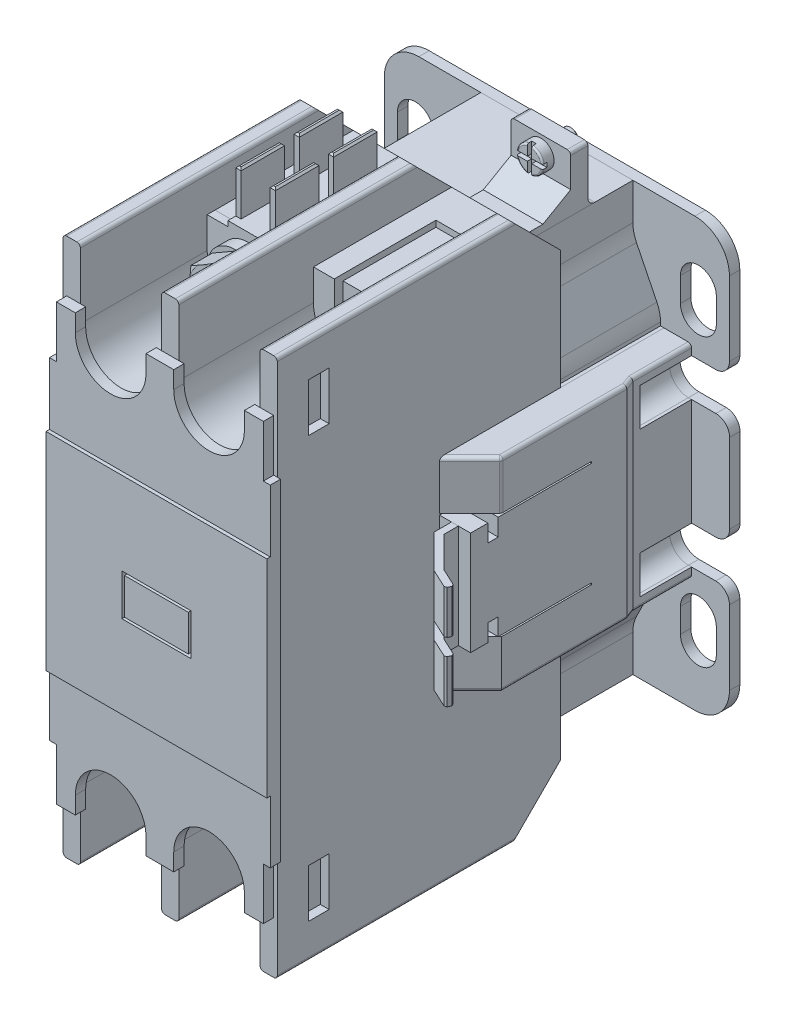
from build123d import *

# Parameters (mm, degrees)
BOSS_EXTRUDE1_DEPTH       = 27.75025
BOSS_EXTRUDE1_DEPTH_BACK  = 13.24975
BOSS_EXTRUDE2_START       = -29.75
BOSS_EXTRUDE2_DEPTH       = 1.50114
BOSS_EXTRUDE3_START       = -13.24975
BOSS_EXTRUDE3_DEPTH       = 14.99911
BOSS_EXTRUDE4_DEPTH       = 21.5011
CUT_EXTRUDE4_START        = -1.27
CUT_EXTRUDE4_DEPTH        = 1.27
SKETCH16_W                = 5.7404
SKETCH16_H                = 0.889
CUT_EXTRUDE5_DEPTH        = 14.732
BOSS_EXTRUDE5_DEPTH       = 1.143
SKETCH10_R                = 4.0005
BOSS_EXTRUDE6_DEPTH       = 1.84912
BOSS_EXTRUDE7_DEPTH       = 3.2258
SKETCH12_OUTSIDE_W        = 559.38
SKETCH12_OUTSIDE_H        = 587.34
SKETCH12_OUTSIDE_R        = 3.288568281
CUT_EXTRUDE3_DEPTH        = 65.048728331
CUT_EXTRUDE3_DRAFT        = -75
SKETCH13_W                = 6.577136562
SKETCH13_H                = 0.762
SKETCH13_W_2              = 0.762
SKETCH13_H_2              = 3.556
CUT_EXTRUDE_THIN1_DEPTH   = 1.27
CUT_EXTRUDE1_DEPTH        = 56.063220588
CUT_EXTRUDE1_DEPTH_BACK   = 56.063220588
SKETCH17_W                = 5.7404
SKETCH17_H                = 1.651
BOSS_EXTRUDE9_DEPTH       = 15.875
SKETCH18_W                = 0.762
SKETCH18_H                = 6.2992
BOSS_EXTRUDE10_DEPTH      = 6.2992
CHAMFER1_SIZE             = 0.254
BOSS_EXTRUDE11_DEPTH      = 15.9889
BOSS_EXTRUDE11_DEPTH_BACK = 15.9889
SKETCH20_W                = 1
SKETCH20_H                = 7.493
CUT_EXTRUDE6_DEPTH        = 76.843305776
BOSS_EXTRUDE12_DEPTH      = 14.732
CUT_EXTRUDE7_DEPTH        = 7.23392
CUT_EXTRUDE8_DEPTH        = 7.493
CUT_EXTRUDE9_DEPTH        = 68.509757213
SKETCH26_R                = 0.75
CUT_EXTRUDE10_DEPTH       = 63.278475094
CUT_EXTRUDE11_DEPTH       = 63.278475094
CUT_EXTRUDE11_DEPTH_BACK  = 63.278475094
SKETCH27_W                = 9.396731614
SKETCH27_H                = 2.405095086
FILLET4_R                 = 0.508
SKETCH28_W                = 10
SKETCH28_H                = 6
CUT_EXTRUDE12_DEPTH       = 7.493
SKETCH29_W                = 9.238
SKETCH29_H                = 5.238
BOSS_EXTRUDE13_DEPTH      = 7.112
BOSS_EXTRUDE14_DEPTH      = 8.636
BOSS_EXTRUDE15_DEPTH      = 1.651
BOSS_EXTRUDE15_DEPTH_BACK = 2.481599
SKETCH31_R                = 1.905
SKETCH33_R                = 1.651
BOSS_EXTRUDE16_DEPTH      = 0.635
SKETCH34_R                = 1.143
BOSS_EXTRUDE17_DEPTH      = 1.27
FILLET1_R                 = 0.254
CHAMFER2_SIZE             = 0.127
SKETCH32_W                = 0.635
SKETCH32_H                = 3.81
SKETCH32_W_2              = 3.81
SKETCH32_H_2              = 0.635
CUT_EXTRUDE_THIN2_DEPTH   = 0.635
FILLET2_R                 = 0.508
FILLET3_R                 = 0.508
SKETCH35_W                = 2.99974
SKETCH35_H                = 7.00024
CUT_EXTRUDE13_DEPTH       = 1.27


# Read off the part's stored shape, not the designer's step: Split1
with BuildPart() as part:
    # Sketch4 → Boss-Extrude1 (new, two sides: drawn at the far end of the back side and taken through both)
    with BuildSketch(Plane.XY.offset(-BOSS_EXTRUDE1_DEPTH_BACK)):
        with BuildLine():
            Line((-15.5063, -38.9993), (-15.5063, 38.9993))
            Line((-15.5063, 38.9993), (-13.0063, 38.9993))
            Line((-13.0063, 38.9993), (-13.0063, 28.9993))
            ThreePointArc((-13.0063, 28.9993), (-7.12815, 23.12115), (-1.25, 28.9993))
            Line((-1.25, 28.9993), (-1.25, 38.9993))
            Line((-1.25, 38.9993), (1.25, 38.9993))
            Line((1.25, 38.9993), (1.25, 28.9993))
            ThreePointArc((1.25, 28.9993), (7.12815, 23.12115), (13.0063, 28.9993))
            Line((13.0063, 28.9993), (13.0063, 38.9993))
            Line((13.0063, 38.9993), (15.5063, 38.9993))
            Line((15.5063, 38.9993), (15.5063, -38.9993))
            Line((15.5063, -38.9993), (13.0063, -38.9993))
            Line((13.0063, -38.9993), (13.0063, -28.9993))
            ThreePointArc((13.0063, -28.9993), (7.12815, -23.12115), (1.25, -28.9993))
            Line((1.25, -28.9993), (1.25, -38.9993))
            Line((1.25, -38.9993), (-1.25, -38.9993))
            Line((-1.25, -38.9993), (-1.25, -28.9993))
            ThreePointArc((-1.25, -28.9993), (-7.12815, -23.12115), (-13.0063, -28.9993))
            Line((-13.0063, -28.9993), (-13.0063, -38.9993))
            Line((-13.0063, -38.9993), (-15.5063, -38.9993))
        make_face()
    extrude(amount=BOSS_EXTRUDE1_DEPTH + BOSS_EXTRUDE1_DEPTH_BACK)

    # Sketch7 → Boss-Extrude3 (add)
    with BuildSketch(Plane.XY.offset(BOSS_EXTRUDE3_START)):
        with BuildLine():
            Line((11.0063, -30.9993), (-11.0063, -30.9993))
            Line((-11.0063, -30.9993), (-11.0063, -25.666452457))
            ThreePointArc((-11.0063, -25.666452457), (-11.137198656, -24.529855738), (-11.523040841, -23.452770611))
            Line((-11.523040841, -23.452770611), (-14.489559159, -17.444829389))
            ThreePointArc((-14.489559159, -17.444829389), (-14.875401344, -16.367744262), (-15.0063, -15.231147543))
            Line((-15.0063, -15.231147543), (-15.0063, -14.731147543))
            Line((-15.0063, -14.731147543), (-15.5063, -14.731147543))
            Line((-15.5063, -14.731147543), (-15.5063, 14.731147543))
            Line((-15.5063, 14.731147543), (-15.0063, 14.731147543))
            Line((-15.0063, 14.731147543), (-15.0063, 15.231147543))
            ThreePointArc((-15.0063, 15.231147543), (-14.875401344, 16.367744262), (-14.489559159, 17.444829389))
            Line((-14.489559159, 17.444829389), (-11.523040841, 23.452770611))
            ThreePointArc((-11.523040841, 23.452770611), (-11.137198656, 24.529855738), (-11.0063, 25.666452457))
            Line((-11.0063, 25.666452457), (-11.0063, 30.9993))
            Line((-11.0063, 30.9993), (11.0063, 30.9993))
            Line((11.0063, 30.9993), (11.0063, 25.666452457))
            ThreePointArc((11.0063, 25.666452457), (11.137198656, 24.529855738), (11.523040841, 23.452770611))
            Line((11.523040841, 23.452770611), (14.489559159, 17.444829389))
            ThreePointArc((14.489559159, 17.444829389), (14.875401344, 16.367744262), (15.0063, 15.231147543))
            Line((15.0063, 15.231147543), (15.0063, 14.731147543))
            Line((15.0063, 14.731147543), (15.5063, 14.731147543))
            Line((15.5063, 14.731147543), (15.5063, -14.731147543))
            Line((15.5063, -14.731147543), (15.0063, -14.731147543))
            Line((15.0063, -14.731147543), (15.0063, -15.231147543))
            ThreePointArc((15.0063, -15.231147543), (14.875401344, -16.367744262), (14.489559159, -17.444829389))
            Line((14.489559159, -17.444829389), (11.523040841, -23.452770611))
            ThreePointArc((11.523040841, -23.452770611), (11.137198656, -24.529855738), (11.0063, -25.666452457))
            Line((11.0063, -25.666452457), (11.0063, -30.9993))
        make_face()
    extrude(amount=-BOSS_EXTRUDE3_DEPTH)

    # Sketch8 → Boss-Extrude4 (add)
    with BuildSketch(Plane.XY.offset(-13.249749999)):
        with BuildLine():
            Line((1.25, 28.9993), (1.25, 33.5002))
            Line((1.25, 33.5002), (13.0063, 33.5002))
            Line((13.0063, 33.5002), (13.0063, 28.9993))
            ThreePointArc((13.0063, 28.9993), (7.12815, 23.12115), (1.25, 28.9993))
        make_face()
        with BuildLine():
            Line((13.0063, -33.5002), (1.25, -33.5002))
            Line((1.25, -33.5002), (1.25, -28.9993))
            ThreePointArc((1.25, -28.9993), (7.12815, -23.12115), (13.0063, -28.9993))
            Line((13.0063, -28.9993), (13.0063, -33.5002))
        make_face()
        with BuildLine():
            Line((-1.25, -28.9993), (-1.25, -33.5002))
            Line((-1.25, -33.5002), (-13.0063, -33.5002))
            Line((-13.0063, -33.5002), (-13.0063, -28.9993))
            ThreePointArc((-13.0063, -28.9993), (-7.12815, -23.12115), (-1.25, -28.9993))
        make_face()
        with BuildLine():
            Line((-13.0063, 33.5002), (-1.25, 33.5002))
            Line((-1.25, 33.5002), (-1.25, 28.9993))
            ThreePointArc((-1.25, 28.9993), (-7.12815, 23.12115), (-13.0063, 28.9993))
            Line((-13.0063, 28.9993), (-13.0063, 33.5002))
        make_face()
    extrude(amount=BOSS_EXTRUDE4_DEPTH)

    # Sketch15 → Cut-Extrude4 (cut)
    with BuildSketch(Plane.XY.offset(8.251350001).offset(CUT_EXTRUDE4_START)):
        with BuildLine():
            Line((-9.99835, 33.5002), (-4.25795, 33.5002))
            Line((-4.25795, 33.5002), (-4.25795, 23.869524237))
            ThreePointArc((-4.25795, 23.869524237), (-7.12815, 23.12115), (-9.99835, 23.869524237))
            Line((-9.99835, 23.869524237), (-9.99835, 33.5002))
        make_face()
        with BuildLine():
            Line((9.99835, 33.5002), (4.25795, 33.5002))
            Line((4.25795, 33.5002), (4.25795, 23.869524237))
            ThreePointArc((4.25795, 23.869524237), (7.12815, 23.12115), (9.99835, 23.869524237))
            Line((9.99835, 23.869524237), (9.99835, 33.5002))
        make_face()
        with BuildLine():
            Line((9.99835, -33.5002), (9.99835, -23.869524237))
            ThreePointArc((9.99835, -23.869524237), (7.12815, -23.12115), (4.25795, -23.869524237))
            Line((4.25795, -23.869524237), (4.25795, -33.5002))
            Line((4.25795, -33.5002), (9.99835, -33.5002))
        make_face()
        with BuildLine():
            Line((-9.99835, -33.5002), (-4.25795, -33.5002))
            Line((-4.25795, -33.5002), (-4.25795, -23.869524237))
            ThreePointArc((-4.25795, -23.869524237), (-7.12815, -23.12115), (-9.99835, -23.869524237))
            Line((-9.99835, -23.869524237), (-9.99835, -33.5002))
        make_face()
    extrude(amount=CUT_EXTRUDE4_DEPTH, mode=Mode.SUBTRACT)

    # Sketch16 → Cut-Extrude5 (cut)
    with BuildSketch(Plane.XY.offset(8.251350001)):
        with Locations((-7.12815, 33.0557)):
            Rectangle(SKETCH16_W, SKETCH16_H)
        with Locations((7.12815, 33.0557)):
            Rectangle(SKETCH16_W, SKETCH16_H)
        with Locations((7.12815, -33.0557)):
            Rectangle(SKETCH16_W, SKETCH16_H)
        with Locations((-7.12815, -33.0557)):
            Rectangle(SKETCH16_W, SKETCH16_H)
    extrude(amount=-CUT_EXTRUDE5_DEPTH, mode=Mode.SUBTRACT)

    # Sketch6 → Cut-Extrude1 (cut, two sides: drawn at the far end of the back side and taken through both)
    with BuildSketch(Plane(origin=(0, 0, 0), x_dir=(0, 0, -1), z_dir=(1, 0, 0)).offset(-CUT_EXTRUDE1_DEPTH_BACK)):
        Polygon((13.249749999, 31.99916693), (13.249749999, 39.5073), (6.249749999, 39.5073), (6.249749999, 38.99916693), align=None)
        Polygon((13.249749999, -39.5073), (6.249749999, -39.5073), (6.249749999, -38.99916693), (13.249749999, -31.99916693), align=None)
    extrude(amount=CUT_EXTRUDE1_DEPTH + CUT_EXTRUDE1_DEPTH_BACK, mode=Mode.SUBTRACT)


with BuildPart() as body_2:
    # Sketch5 → Boss-Extrude2 (new body)
    with BuildSketch(Plane.XY.offset(BOSS_EXTRUDE2_START)):
        with BuildLine():
            Line((19.9937, 30.9993), (-19.9937, 30.9993))
            ThreePointArc((-19.9937, 30.9993), (-23.529233906, 29.534833906), (-24.9937, 25.9993))
            Line((-24.9937, 25.9993), (-24.9937, 15.257233919))
            ThreePointArc((-24.9937, 15.257233919), (-24.407913562, 13.843020357), (-22.9937, 13.257233919))
            Line((-22.9937, 13.257233919), (-19.052007326, 13.257233919))
            ThreePointArc((-19.052007326, 13.257233919), (-16.302007326, 10.507233919), (-19.052007326, 7.757233919))
            Line((-19.052007326, 7.757233919), (-23.019, 7.757233919))
            ThreePointArc((-23.019, 7.757233919), (-24.433213562, 7.171447482), (-25.019, 5.757233919))
            Line((-25.019, 5.757233919), (-25.019, -5.757233919))
            ThreePointArc((-25.019, -5.757233919), (-24.433213562, -7.171447482), (-23.019, -7.757233919))
            Line((-23.019, -7.757233919), (-19.052007326, -7.757233919))
            ThreePointArc((-19.052007326, -7.757233919), (-16.302007326, -10.507233919), (-19.052007326, -13.257233919))
            Line((-19.052007326, -13.257233919), (-22.9937, -13.257233919))
            ThreePointArc((-22.9937, -13.257233919), (-24.407913562, -13.843020357), (-24.9937, -15.257233919))
            Line((-24.9937, -15.257233919), (-24.9937, -25.9993))
            ThreePointArc((-24.9937, -25.9993), (-23.529233906, -29.534833906), (-19.9937, -30.9993))
            Line((-19.9937, -30.9993), (19.9937, -30.9993))
            ThreePointArc((19.9937, -30.9993), (23.529233906, -29.534833906), (24.9937, -25.9993))
            Line((24.9937, -25.9993), (24.9937, -15.257233919))
            ThreePointArc((24.9937, -15.257233919), (24.407913562, -13.843020357), (22.9937, -13.257233919))
            Line((22.9937, -13.257233919), (19.052007326, -13.257233919))
            ThreePointArc((19.052007326, -13.257233919), (16.302007326, -10.507233919), (19.052007326, -7.757233919))
            Line((19.052007326, -7.757233919), (23.019, -7.757233919))
            ThreePointArc((23.019, -7.757233919), (24.433213562, -7.171447482), (25.019, -5.757233919))
            Line((25.019, -5.757233919), (25.019, 5.757233919))
            ThreePointArc((25.019, 5.757233919), (24.433213562, 7.171447482), (23.019, 7.757233919))
            Line((23.019, 7.757233919), (19.052007326, 7.757233919))
            ThreePointArc((19.052007326, 7.757233919), (16.302007326, 10.507233919), (19.052007326, 13.257233919))
            Line((19.052007326, 13.257233919), (22.9937, 13.257233919))
            ThreePointArc((22.9937, 13.257233919), (24.407913562, 13.843020357), (24.9937, 15.257233919))
            Line((24.9937, 15.257233919), (24.9937, 25.9993))
            ThreePointArc((24.9937, 25.9993), (23.529233906, 29.534833906), (19.9937, 30.9993))
        make_face()
        with BuildLine():
            Line((23.0936948, 22.4983), (23.0936948, 18.9983))
            ThreePointArc((23.0936948, 18.9983), (20.4937, 16.3983052), (17.8937052, 18.9983))
            Line((17.8937052, 18.9983), (17.8937052, 22.4983))
            ThreePointArc((17.8937052, 22.4983), (20.4937, 25.0982948), (23.0936948, 22.4983))
        make_face(mode=Mode.SUBTRACT)
        with BuildLine():
            Line((17.8937052, -18.9983), (17.8937052, -22.4983))
            ThreePointArc((17.8937052, -22.4983), (20.4937, -25.0982948), (23.0936948, -22.4983))
            Line((23.0936948, -22.4983), (23.0936948, -18.9983))
            ThreePointArc((23.0936948, -18.9983), (20.4937, -16.3983052), (17.8937052, -18.9983))
        make_face(mode=Mode.SUBTRACT)
        with BuildLine():
            Line((-23.0936948, -22.4983), (-23.0936948, -18.9983))
            ThreePointArc((-23.0936948, -18.9983), (-20.4937, -16.3983052), (-17.8937052, -18.9983))
            Line((-17.8937052, -18.9983), (-17.8937052, -22.4983))
            ThreePointArc((-17.8937052, -22.4983), (-20.4937, -25.0982948), (-23.0936948, -22.4983))
        make_face(mode=Mode.SUBTRACT)
        with BuildLine():
            Line((-17.8937052, 18.9983), (-17.8937052, 22.4983))
            ThreePointArc((-17.8937052, 22.4983), (-20.4937, 25.0982948), (-23.0936948, 22.4983))
            Line((-23.0936948, 22.4983), (-23.0936948, 18.9983))
            ThreePointArc((-23.0936948, 18.9983), (-20.4937, 16.3983052), (-17.8937052, 18.9983))
        make_face(mode=Mode.SUBTRACT)
    extrude(amount=BOSS_EXTRUDE2_DEPTH)


with BuildPart() as body_3:
    # Sketch9 → Boss-Extrude5 (new body)
    with BuildSketch(Plane.XY.offset(8.251350001)):
        with BuildLine():
            Line((-1.25, 33.5002), (-1.25, 28.9993))
            ThreePointArc((-1.25, 28.9993), (-7.12815, 23.12115), (-13.0063, 28.9993))
            Line((-13.0063, 28.9993), (-13.0063, 33.5002))
            Line((-13.0063, 33.5002), (-1.25, 33.5002))
        make_face()
    extrude(amount=BOSS_EXTRUDE5_DEPTH)

    # Sketch10 → Boss-Extrude6 (add)
    with BuildSketch(Plane.XY.offset(9.394350001)):
        with Locations((-7.12815, 28.9993)):
            Circle(SKETCH10_R)
    extrude(amount=BOSS_EXTRUDE6_DEPTH)

    # Sketch11 → Boss-Extrude7 (add)
    with BuildSketch(Plane.XY.offset(11.243470001)):
        Polygon((-3.839581719, 30.897955782), (-7.12815, 32.796611565), (-10.416718281, 30.897955782), (-10.416718281, 27.100644218), (-7.12815, 25.201988435), (-3.839581719, 27.100644218), align=None)
    extrude(amount=BOSS_EXTRUDE7_DEPTH)


with BuildPart() as cut_extrude3_tool:
    # Sketch12 outside → Cut-Extrude3 (with draft: the straight prism first)
    with BuildSketch(Plane.XY.offset(14.469270001)):
        Rectangle(SKETCH12_OUTSIDE_W, SKETCH12_OUTSIDE_H)
        with Locations((-7.12815, 28.9993)):
            Circle(SKETCH12_OUTSIDE_R, mode=Mode.SUBTRACT)
    extrude(amount=-CUT_EXTRUDE3_DEPTH)
    # Cut-Extrude3: the draft: its side faces are tilted about the plane it starts from
    cut_extrude3_sides = [cut_extrude3_tool.faces().sort_by_distance(p)[0] for p in [
        (0, -293.67, -18.055094165),
        (279.69, 0, -18.055094165),
        (0, 293.67, -18.055094165),
        (-279.69, 0, -18.055094165),
        (-10.416718281, 28.9993, -18.055094165),
    ]]
    draft(cut_extrude3_sides, Plane.XY.offset(14.469270001), CUT_EXTRUDE3_DRAFT)


with BuildPart() as body_3_1:
    add(body_3.part)

    # Cut-Extrude3: cut by cut_extrude3_tool
    add(cut_extrude3_tool.part, mode=Mode.SUBTRACT)

    # Sketch13 → Cut-Extrude-Thin1 (cut)
    with BuildSketch(Plane.XY.offset(14.469270001)):
        with Locations((-7.12815, 28.9993)):
            Rectangle(SKETCH13_W, SKETCH13_H)
        with Locations((-7.12815, 28.9993)):
            Rectangle(SKETCH13_W_2, SKETCH13_H_2)
    extrude(amount=-CUT_EXTRUDE_THIN1_DEPTH, mode=Mode.SUBTRACT)

    # Sketch17 → Boss-Extrude9 (add)
    with BuildSketch(Plane.XY.offset(-6.480649999)):
        with Locations((-7.12815, 33.4367)):
            Rectangle(SKETCH17_W, SKETCH17_H)
    extrude(amount=BOSS_EXTRUDE9_DEPTH)

    # Sketch18 → Boss-Extrude10 (add)
    with BuildSketch(Plane(origin=(0, 34.2622, 0), x_dir=(1, 0, 0), z_dir=(0, 1, 0))):
        with Locations((-9.61735, 3.331049999)):
            Rectangle(SKETCH18_W, SKETCH18_H)
        with Locations((-9.61735, -5.101750001)):
            Rectangle(SKETCH18_W, SKETCH18_H)
        with Locations((-4.63895, -5.101750001)):
            Rectangle(SKETCH18_W, SKETCH18_H)
        with Locations((-4.63895, 3.331049999)):
            Rectangle(SKETCH18_W, SKETCH18_H)
    extrude(amount=BOSS_EXTRUDE10_DEPTH)

    # Chamfer1
    chamfer1_edges = [body_3_1.edges().sort_by_distance(p)[0] for p in [
        (-9.99835, 40.5614, -3.331049999),
        (-9.61735, 40.5614, -0.181449999),
        (-9.23635, 40.5614, -3.331049999),
        (-9.61735, 40.5614, -6.480649999),
        (-9.99835, 40.5614, 5.101750001),
        (-9.61735, 40.5614, 8.251350001),
        (-9.23635, 40.5614, 5.101750001),
        (-9.61735, 40.5614, 1.952150001),
        (-4.63895, 40.5614, 1.952150001),
        (-5.01995, 40.5614, 5.101750001),
        (-4.63895, 40.5614, 8.251350001),
        (-4.25795, 40.5614, 5.101750001),
        (-4.63895, 40.5614, -0.181449999),
        (-4.25795, 40.5614, -3.331049999),
        (-4.63895, 40.5614, -6.480649999),
        (-5.01995, 40.5614, -3.331049999),
    ]]
    chamfer(chamfer1_edges, length=CHAMFER1_SIZE)


with BuildPart() as body_4:
    # Mirror1: mirrored copy
    add(body_3_1.part.mirror(Plane.ZX))


with BuildPart() as body_5:
    # Sketch19 → Boss-Extrude11 (new, two sides: drawn at the far end of the back side and taken through both)
    with BuildSketch(Plane(origin=(0, 0, 0), x_dir=(0, 0, -1), z_dir=(1, 0, 0)).offset(-BOSS_EXTRUDE11_DEPTH_BACK)):
        Polygon((-27.75025, 31.4993), (-29.25025, 31.4993), (-29.25025, 14.9993), (-29.75, 14.9993), (-29.75, -14.9993), (-29.25025, -14.9993), (-29.25025, -31.4993), (-27.75025, -31.4993), align=None)
    extrude(amount=BOSS_EXTRUDE11_DEPTH + BOSS_EXTRUDE11_DEPTH_BACK)

    # Sketch20 → Cut-Extrude6 (cut, through all)
    with BuildSketch(Plane.XY.offset(29.25025)):
        with BuildLine():
            Line((-2.012, 28.9993), (-2.012, 31.4993))
            Line((-2.012, 31.4993), (-12.2443, 31.4993))
            Line((-12.2443, 31.4993), (-12.2443, 28.9993))
            ThreePointArc((-12.2443, 28.9993), (-7.12815, 23.88315), (-2.012, 28.9993))
        make_face()
        with BuildLine():
            Line((12.2443, 31.4993), (12.2443, 28.9993))
            ThreePointArc((12.2443, 28.9993), (7.12815, 23.88315), (2.012, 28.9993))
            Line((2.012, 28.9993), (2.012, 31.4993))
            Line((2.012, 31.4993), (12.2443, 31.4993))
        make_face()
        with BuildLine():
            Line((2.012, -28.9993), (2.012, -31.4993))
            Line((2.012, -31.4993), (12.2443, -31.4993))
            Line((12.2443, -31.4993), (12.2443, -28.9993))
            ThreePointArc((12.2443, -28.9993), (7.12815, -23.88315), (2.012, -28.9993))
        make_face()
        with BuildLine():
            Line((-12.2443, -31.4993), (-12.2443, -28.9993))
            ThreePointArc((-12.2443, -28.9993), (-7.12815, -23.88315), (-2.012, -28.9993))
            Line((-2.012, -28.9993), (-2.012, -31.4993))
            Line((-2.012, -31.4993), (-12.2443, -31.4993))
        make_face()
        with Locations((-15.4889, 27.7528)):
            Rectangle(SKETCH20_W, SKETCH20_H)
        with Locations((15.4889, 27.7528)):
            Rectangle(SKETCH20_W, SKETCH20_H)
        with Locations((15.4889, -27.7528)):
            Rectangle(SKETCH20_W, SKETCH20_H)
        with Locations((-15.4889, -27.7528)):
            Rectangle(SKETCH20_W, SKETCH20_H)
    extrude(amount=-CUT_EXTRUDE6_DEPTH, mode=Mode.SUBTRACT)


with BuildPart() as body_6:
    # Sketch21 → Boss-Extrude12 (new, symmetric)
    with BuildSketch(Plane(origin=(0, 0, 0), x_dir=(1, 0, 0), z_dir=(0, 1, 0))):
        Polygon((-15.5063, 28.24886), (-15.5063, -4.25114), (-17.234111412, -4.25114), (-17.234111412, -6.75114), (-22.104472317, -11.621500905), (-24.779723152, -12.868990857), (-25.111954664, -12.748068475), (-25.323263795, -12.294914582), (-25.202341414, -11.96268307), (-22.686897094, -10.78971212), (-18.234111412, -6.336926438), (-18.234111412, -4.25114), (-20.006300099, -4.25114), (-20.006300099, 18.37512129), (-19.506300099, 19.74886), (-19.506300099, 28.24886), align=None)
    extrude(amount=BOSS_EXTRUDE12_DEPTH, both=True)

    # Sketch22 → Cut-Extrude7 (cut)
    with BuildSketch(Plane(origin=(0, 14.732, 0), x_dir=(1, 0, 0), z_dir=(0, 1, 0))):
        Polygon((-15.5063, -4.25114), (-20.006300099, 0.24975), (-20.006300099, -4.25114), (-18.234111412, -4.25114), (-18.234111412, -6.336926438), (-22.686897094, -10.78971212), (-25.202341414, -11.96268307), (-25.323263795, -12.294914582), (-25.111954664, -12.748068475), (-24.779723152, -12.868990857), (-22.104472317, -11.621500905), (-17.234111412, -6.75114), (-17.234111412, -4.25114), align=None)
    cut_extrude7 = extrude(amount=-CUT_EXTRUDE7_DEPTH, mode=Mode.SUBTRACT)

    # Sketch23 → Cut-Extrude8 (cut)
    with BuildSketch(Plane(origin=(0, 0, -28.24886), x_dir=(-1, 0, 0), z_dir=(0, 0, -1))):
        with BuildLine():
            Line((19.506300099, 13.257233919), (19.052007326, 13.257233919))
            ThreePointArc((19.052007326, 13.257233919), (16.302007326, 10.507233919), (19.052007326, 7.757233919))
            Line((19.052007326, 7.757233919), (19.506300099, 7.757233919))
            Line((19.506300099, 7.757233919), (19.506300099, 13.257233919))
        make_face()
        with BuildLine():
            Line((19.506300099, -7.757233919), (19.052007326, -7.757233919))
            ThreePointArc((19.052007326, -7.757233919), (16.302007326, -10.507233919), (19.052007326, -13.257233919))
            Line((19.052007326, -13.257233919), (19.506300099, -13.257233919))
            Line((19.506300099, -13.257233919), (19.506300099, -7.757233919))
        make_face()
    cut_extrude8 = extrude(amount=-CUT_EXTRUDE8_DEPTH, mode=Mode.SUBTRACT)

    # Sketch24 → Cut-Extrude9 (cut, through all)
    with BuildSketch(Plane.ZY.offset(20.006300099)):
        Polygon((4.25114, 7.49808), (1.75114, 7.49808), (1.75114, 4.99808), (0.25114, 4.99808), (0.25114, 7.49808), (-13.24886, 7.49808), (-13.24886, 7.731775085), (4.25114, 7.731775085), align=None)
    cut_extrude9 = extrude(amount=-CUT_EXTRUDE9_DEPTH, mode=Mode.SUBTRACT)

    # Sketch26 → Cut-Extrude10 (cut, through all)
    with BuildSketch(Plane(origin=(-5.948592487, 0, -5.948592487), x_dir=(-0.7071067811865531, 0, 0.7071067811865419), z_dir=(-0.7071067811865419, 0, -0.7071067811865531))):
        with Locations((20.373718089, 4.247452457)):
            Circle(SKETCH26_R)
    cut_extrude10 = extrude(amount=-CUT_EXTRUDE10_DEPTH, mode=Mode.SUBTRACT)

    # Sketch27 → Cut-Extrude11 (cut, two sides: drawn at the far end of the back side and taken through both)
    with BuildSketch(Plane(origin=(-5.948592487, 0, -5.948592487), x_dir=(-0.7071067811865531, 0, 0.7071067811865419), z_dir=(-0.7071067811865419, 0, -0.7071067811865531)).offset(-CUT_EXTRUDE11_DEPTH_BACK)):
        with Locations((22.072713291, 0)):
            Rectangle(SKETCH27_W, SKETCH27_H)
    extrude(amount=CUT_EXTRUDE11_DEPTH + CUT_EXTRUDE11_DEPTH_BACK, mode=Mode.SUBTRACT)

    # Mirror2: Cut-Extrude7, Cut-Extrude8, Cut-Extrude9, Cut-Extrude10 across plane
    add(cut_extrude7.mirror(Plane.ZX), mode=Mode.SUBTRACT)
    add(cut_extrude8.mirror(Plane.ZX), mode=Mode.SUBTRACT)
    add(cut_extrude9.mirror(Plane.ZX), mode=Mode.SUBTRACT)
    add(cut_extrude10.mirror(Plane.ZX), mode=Mode.SUBTRACT)

    # Fillet4
    fillet4_edges = [body_6.edges().sort_by_distance(p)[0] for p in [
        (-17.75630005, -14.732, 2.000695),
        (-20.006300099, -14.732, -9.312435645),
        (-19.756300099, -14.732, -19.061990645),
        (-19.506300099, -14.732, -23.99886),
        (-17.75630005, 14.732, 2.000695),
        (-19.506300099, 14.732, -23.99886),
        (-19.756300099, 14.732, -19.061990645),
        (-20.006300099, 14.732, -9.312435645),
        (-20.006300099, 11.231887543, -0.24975),
    ]]
    fillet(fillet4_edges, radius=FILLET4_R)


with BuildPart() as body_7:
    # Split1: the piece on the far side of the plane
    add(body_6.part)
    split(bisect_by=Plane.XY.offset(4.25114), keep=Keep.BOTTOM)


with BuildPart() as body_6_1:
    add(body_6.part)

    # Split1
    split(bisect_by=Plane.XY.offset(4.25114), keep=Keep.TOP)


with BuildPart() as body_8:
    # Mirror4: mirrored copy
    add(body_6_1.part.mirror(Plane(origin=(0, 0, 0), x_dir=(0, 0, 1), z_dir=(1, 0, 0))))


with BuildPart() as body_9:
    # Mirror4 2: mirrored copy
    add(body_7.part.mirror(Plane(origin=(0, 0, 0), x_dir=(0, 0, 1), z_dir=(1, 0, 0))))


with BuildPart() as body_7_1:
    add(body_7.part)

    # Combine1: union body 9, part
    add(body_9.part)
    add(part.part)


with BuildPart() as cut_extrude12_tool:
    # Sketch28 → Cut-Extrude12 (new body)
    with BuildSketch(Plane.XY.offset(29.75)):
        Rectangle(SKETCH28_W, SKETCH28_H)
    extrude(amount=-CUT_EXTRUDE12_DEPTH)


with BuildPart() as body_5_1:
    add(body_5.part)

    # Cut-Extrude12: cut by cut_extrude12_tool
    add(cut_extrude12_tool.part, mode=Mode.SUBTRACT)


with BuildPart() as body_7_2:
    add(body_7_1.part)

    # Cut-Extrude12: cut by cut_extrude12_tool
    add(cut_extrude12_tool.part, mode=Mode.SUBTRACT)

    # Fillet3
    fillet3_edges = [body_7_2.edges().sort_by_distance(p)[0] for p in [
        (-15.5063, -38.9993, 10.75025),
        (-13.0063, -38.9993, 10.75025),
        (-1.25, -38.9993, 10.75025),
        (1.25, -38.9993, 10.75025),
        (13.0063, -38.9993, 10.75025),
        (15.5063, -38.9993, 10.75025),
        (-15.5063, 38.9993, 10.75025),
        (-13.0063, 38.9993, 10.75025),
        (-1.25, 38.9993, 10.75025),
        (1.25, 38.9993, 10.75025),
        (13.0063, 38.9993, 10.75025),
        (15.5063, 38.9993, 10.75025),
    ]]
    fillet(fillet3_edges, radius=FILLET3_R)

    # Sketch35 → Cut-Extrude13 (cut)
    with BuildSketch(Plane(origin=(15.5063, 0, 0), x_dir=(0, 0, -1), z_dir=(1, 0, 0))):
        with Locations((-21.75077, 30.4649)):
            Rectangle(SKETCH35_W, SKETCH35_H)
        with Locations((-21.75077, -30.4649)):
            Rectangle(SKETCH35_W, SKETCH35_H)
    cut_extrude13 = extrude(amount=-CUT_EXTRUDE13_DEPTH, mode=Mode.SUBTRACT)

    # Mirror7: Cut-Extrude13 across plane
    add(cut_extrude13.mirror(Plane(origin=(0, 0, 0), x_dir=(0, 0, 1), z_dir=(1, 0, 0))), mode=Mode.SUBTRACT)


with BuildPart() as body_8_2:
    # Sketch29 → Boss-Extrude13 (new body)
    with BuildSketch(Plane.XY.offset(29.75)):
        Rectangle(SKETCH29_W, SKETCH29_H)
    extrude(amount=-BOSS_EXTRUDE13_DEPTH)


with BuildPart() as body_9_2:
    # Sketch30 → Boss-Extrude14 (new body)
    with BuildSketch(Plane.ZY.offset(-11.0063)):
        with BuildLine():
            Line((-13.249749999, 31.99916693), (-15.222127944, 31.99916693))
            Line((-15.222127944, 31.99916693), (-19.24975, 34.324515609))
            Line((-19.24975, 34.324515609), (-19.24975, 39.101915464))
            Line((-19.24975, 39.101915464), (-21.731349441, 39.101915464))
            Line((-21.731349441, 39.101915464), (-21.731349441, 31.999300001))
            ThreePointArc((-21.731349441, 31.999300001), (-22.024242659, 31.29219322), (-22.731349441, 30.999300001))
            Line((-22.731349441, 30.999300001), (-13.249749999, 30.999300001))
            Line((-13.249749999, 30.999300001), (-13.249749999, 31.99916693))
        make_face()
    extrude(amount=BOSS_EXTRUDE14_DEPTH)

    # Fillet2
    fillet2_edges = [body_9_2.edges().sort_by_distance(p)[0] for p in [
        (2.3703, 39.101915464, -20.49054972),
        (11.0063, 39.101915464, -20.49054972),
    ]]
    fillet(fillet2_edges, radius=FILLET2_R)


with BuildPart() as body_10:
    # Sketch31 → Boss-Extrude15 (new, two sides: drawn at the far end of the back side and taken through both)
    with BuildSketch(Plane.XY.offset(-19.24975).offset(-BOSS_EXTRUDE15_DEPTH_BACK)):
        with Locations((6.6883, 36.713215536)):
            Circle(SKETCH31_R)
    extrude(amount=BOSS_EXTRUDE15_DEPTH + BOSS_EXTRUDE15_DEPTH_BACK)


with BuildPart() as boss_extrude16_tool:
    # Sketch33 → Boss-Extrude16 (new body)
    with BuildSketch(Plane(origin=(0, 0, -21.731349441), x_dir=(-1, 0, 0), z_dir=(0, 0, -1))):
        with Locations((-6.6883, 36.713215536)):
            Circle(SKETCH33_R)
    extrude(amount=BOSS_EXTRUDE16_DEPTH)


with BuildPart() as body_10_1:
    add(body_10.part)


with BuildPart() as body_10_2:
    # Boss-Extrude16: joined with boss_extrude16_tool
    add(body_10_1.part.fuse(boss_extrude16_tool.part, tol=0.00001))

    # Sketch34 → Boss-Extrude17 (add)
    with BuildSketch(Plane(origin=(0, 0, -22.366349441), x_dir=(-1, 0, 0), z_dir=(0, 0, -1))):
        with Locations((-6.6883, 36.713215536)):
            Circle(SKETCH34_R)
    extrude(amount=BOSS_EXTRUDE17_DEPTH)

    # Fillet1
    fillet1_edges = [body_10_2.edges().sort_by_distance(p)[0] for p in [
        (4.7833, 36.713215536, -17.59875),
    ]]
    fillet(fillet1_edges, radius=FILLET1_R)

    # Chamfer2
    chamfer2_edges = [body_10_2.edges().sort_by_distance(p)[0] for p in [
        (7.8313, 36.713215536, -23.636349441),
    ]]
    chamfer(chamfer2_edges, length=CHAMFER2_SIZE)

    # Sketch32 → Cut-Extrude-Thin2 (cut)
    with BuildSketch(Plane.XY.offset(-17.59875)):
        with Locations((6.6883, 36.713215536)):
            Rectangle(SKETCH32_W, SKETCH32_H)
        with Locations((6.6883, 36.713215536)):
            Rectangle(SKETCH32_W_2, SKETCH32_H_2)
    extrude(amount=-CUT_EXTRUDE_THIN2_DEPTH, mode=Mode.SUBTRACT)


with BuildPart() as body_11:
    # Mirror5: mirrored copy
    add(body_10_2.part.mirror(Plane.ZX))


with BuildPart() as body_12:
    # Mirror5 2: mirrored copy
    add(body_9_2.part.mirror(Plane.ZX))


with BuildPart() as body_13:
    # Mirror6: mirrored copy
    add(body_9_2.part.mirror(Plane(origin=(0, 0, 0), x_dir=(0, 0, 1), z_dir=(1, 0, 0))))


with BuildPart() as body_14:
    # Mirror6 2: mirrored copy
    add(body_10_2.part.mirror(Plane(origin=(0, 0, 0), x_dir=(0, 0, 1), z_dir=(1, 0, 0))))


with BuildPart() as body_15:
    # Mirror6 3: mirrored copy
    add(body_11.part.mirror(Plane(origin=(0, 0, 0), x_dir=(0, 0, 1), z_dir=(1, 0, 0))))


with BuildPart() as body_16:
    # Mirror6 4: mirrored copy
    add(body_12.part.mirror(Plane(origin=(0, 0, 0), x_dir=(0, 0, 1), z_dir=(1, 0, 0))))


solid = Compound([body_2.part, body_3_1.part, body_4.part, body_6_1.part, body_8.part, body_5_1.part, body_7_2.part, body_8_2.part, body_9_2.part, body_10_2.part, body_15.part, body_16.part])
